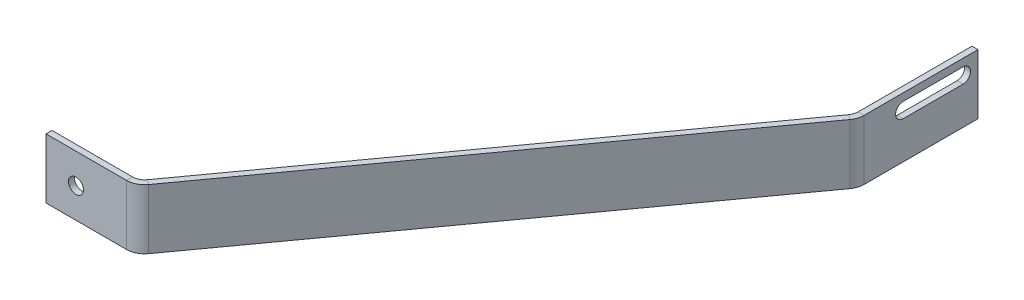
from build123d import *

# Parameters (mm, degrees)
BOSS_EXTRUDE1_DEPTH  = 20
CONVERT_SOLID2_DEPTH = 20
SKETCH8_R            = 2.5
CUT_EXTRUDE1_DEPTH   = 20
CUT_EXTRUDE2_DEPTH   = 10


# Read off the part's stored shape, not the designer's step: Convert-Solid2
with BuildPart() as part:
    # Sketch1 → Boss-Extrude1 (new body)
    with BuildSketch(Plane(origin=(0, 0, 0), x_dir=(1, 0, 0), z_dir=(0, 1, 0))):
        Polygon((0, 0), (30, 0), (131.25, 140), (131.25, 180), (126.25, 180), (126.25, 141.618570234), (27.445498313, 5), (0, 5), align=None)
    extrude(amount=BOSS_EXTRUDE1_DEPTH)

    # Convert-Solid2 outline → Convert-Solid2 (cut)
    with BuildSketch(Plane(origin=(0, 0, 0), x_dir=(1, 0, 0), z_dir=(0, 1, 0))):
        with BuildLine():
            Line((30, 0), (31.796383005, 2.483887612))
            ThreePointArc((31.796383005, 2.483887612), (29.664371379, 0.656935602), (26.934597975, 0))
            Line((26.934597975, 0), (30, 0))
        make_face()
        with BuildLine():
            ThreePointArc((131.25, 141.942284281), (130.958358353, 140.094408498), (130.11178503, 138.426171893))
            Line((130.11178503, 138.426171893), (131.25, 140))
            Line((131.25, 140), (131.25, 141.942284281))
        make_face()
        with BuildLine():
            Line((0, 5), (0, 2))
            Line((0, 2), (26.934597975, 2))
            ThreePointArc((26.934597975, 2), (28.754446911, 2.437957068), (30.175787995, 3.655925075))
            Line((30.175787995, 3.655925075), (128.49119002, 139.598209356))
            ThreePointArc((128.49119002, 139.598209356), (129.055572236, 140.710367092), (129.25, 141.942284281))
            Line((129.25, 141.942284281), (129.25, 180))
            Line((129.25, 180), (126.25, 180))
            Line((126.25, 180), (126.25, 141.618570234))
            Line((126.25, 141.618570234), (27.445498313, 5))
            Line((27.445498313, 5), (0, 5))
        make_face()
    extrude(amount=CONVERT_SOLID2_DEPTH, mode=Mode.SUBTRACT)

    # Sketch8 → Cut-Extrude1 (cut)
    with BuildSketch(Plane.XY):
        with Locations((10, 10)):
            Circle(SKETCH8_R)
    extrude(amount=-CUT_EXTRUDE1_DEPTH, mode=Mode.SUBTRACT)

    # Sketch9 → Cut-Extrude2 (cut)
    with BuildSketch(Plane(origin=(131.25, 0, -320.372504423), x_dir=(0, 0, 1), z_dir=(-1, 0, 0))):
        with BuildLine():
            Line((145.372504423, 17.5), (165.372504423, 17.5))
            ThreePointArc((165.372504423, 17.5), (167.872504423, 15), (165.372504423, 12.5))
            Line((165.372504423, 12.5), (145.372504423, 12.5))
            ThreePointArc((145.372504423, 12.5), (142.872504423, 15), (145.372504423, 17.5))
        make_face()
    extrude(amount=CUT_EXTRUDE2_DEPTH, mode=Mode.SUBTRACT)


solid = part.part
